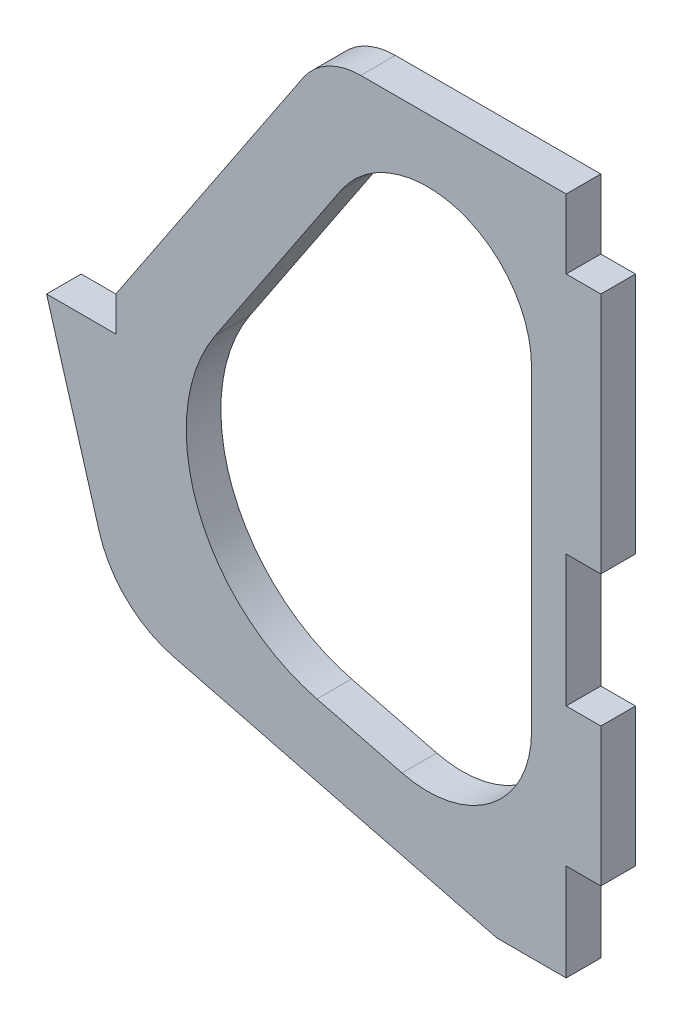
from build123d import *

# Parameters (mm, degrees)
DODANIE_WYCI_GNI_CIE1_DEPTH = 5


with BuildPart() as part:
    # Szkic1 → Dodanie-wyciągnięcie1 (new body)
    with BuildSketch(Plane.XY):
        with BuildLine():
            Line((9.722933235, -5.885177863), (14.722933235, -5.885177863))
            Line((14.722933235, -5.885177863), (14.722933235, -25.885177863))
            Line((14.722933235, -25.885177863), (9.722933235, -25.885177863))
            Line((9.722933235, -25.885177863), (9.722933235, -39.885177863))
            Line((9.722933235, -39.885177863), (-0.277066765, -39.885177863))
            Line((-0.277066765, -39.885177863), (-46.979021146, -28.054016087))
            ThreePointArc((-46.979021146, -28.054016087), (-53.701758158, -24.316476154), (-57.688109888, -17.738224292))
            Line((-57.688109888, -17.738224292), (-65.277066765, 8.114822137))
            Line((-65.277066765, 8.114822137), (-55.277066765, 8.114822137))
            Line((-55.277066765, 8.114822137), (-55.277066765, 13.114822137))
            Line((-55.277066765, 13.114822137), (-28.245732124, 53.661824099))
            ThreePointArc((-28.245732124, 53.661824099), (-24.643808436, 56.931568124), (-19.92522918, 58.114822137))
            Line((-19.92522918, 58.114822137), (9.722933235, 58.114822137))
            Line((9.722933235, 58.114822137), (9.722933235, 48.114822137))
            Line((9.722933235, 48.114822137), (14.722933235, 48.114822137))
            Line((14.722933235, 48.114822137), (14.722933235, 13.114822137))
            Line((14.722933235, 13.114822137), (9.722933235, 13.114822137))
            Line((9.722933235, 13.114822137), (9.722933235, -5.885177863))
        make_face()
        with BuildLine():
            Line((4.722933235, 34.031553005), (4.722933235, -11.562096352))
            ThreePointArc((4.722933235, -11.562096352), (-1.064426371, -23.399632285), (-13.960701027, -26.102757912))
            Line((-13.960701027, -26.102757912), (-26.254856655, -22.988238487))
            ThreePointArc((-26.254856655, -22.988238487), (-43.447613566, -7.732159871), (-40.916723576, 15.113702354))
            Line((-40.916723576, 15.113702354), (-22.75782118, 42.352055948))
            ThreePointArc((-22.75782118, 42.352055948), (-5.930304535, 48.387933402), (4.722933235, 34.031553005))
        make_face(mode=Mode.SUBTRACT)
    extrude(amount=DODANIE_WYCI_GNI_CIE1_DEPTH)


solid = part.part
